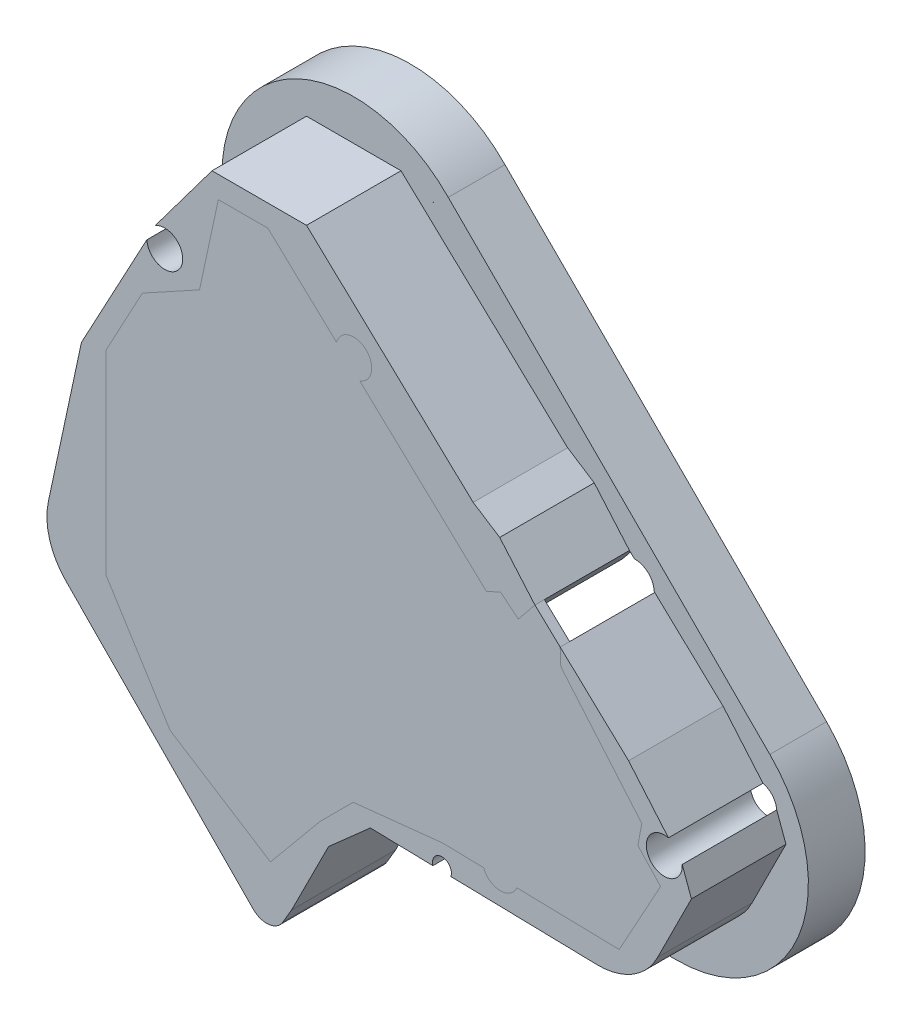
from build123d import *

# Parameters (mm, degrees)
BOSS_EXTRUDE1_DEPTH      = 27.94
SKETCH1_4_R              = 4.445
SKETCH1_4_R_2            = 2.032
SKETCH1_4_R_3            = 2.0193
BOSS_EXTRUDE2_DEPTH      = 5.08
BOSS_EXTRUDE3_DEPTH      = 2.54
BOSS_EXTRUDE4_DEPTH      = 2.54
BOSS_EXTRUDE4_DEPTH_BACK = 12.7
BOSS_EXTRUDE5_DEPTH      = 2.54
CUT_EXTRUDE2_DEPTH       = 176.272405321
BOSS_EXTRUDE7_DEPTH      = 2.54


with BuildPart() as part:
    # Sketch1 → Boss-Extrude1 (new body)
    with BuildSketch(Plane.XY):
        with BuildLine():
            ThreePointArc((-56.507300171, 12.537235488), (-56.195803813, 3.848751471), (-51.801985551, -3.653324614))
            Line((-51.801985551, -3.653324614), (-1.47570348, -54.850767255))
            ThreePointArc((-1.47570348, -54.850767255), (2.772016994, -56.331034197), (6.529742955, -53.858421196))
            Line((6.529742955, -53.858421196), (8.86743597, -49.87006403))
            Line((8.86743597, -49.87006403), (18.794900521, -30.155662993))
            Line((18.794900521, -30.155662993), (30.015464801, -20.224261861))
            Line((30.015464801, -20.224261861), (90.906521033, -21.585518505))
            ThreePointArc((90.906521033, -21.585518505), (100.475537269, -19.041819588), (107.200283399, -11.7744772))
            Line((107.200283399, -11.7744772), (116.311189347, 6.409978492))
            Line((116.311189347, 6.409978492), (113.829291982, 13.184806868))
            ThreePointArc((113.829291982, 13.184806868), (105.340047507, 9.70868308), (110.132255745, 17.530795873))
            Line((110.132255745, 17.530795873), (99.420817942, 30.122447115))
            Line((99.420817942, 30.122447115), (81.037096807, 47.39593724))
            Line((81.037096807, 47.39593724), (81.2028603, 42.898970903))
            Line((81.2028603, 42.898970903), (102.978646989, 17.30080971))
            Line((102.978646989, 17.30080971), (101.915981854, 11.639329767))
            Line((101.915981854, 11.639329767), (108.017908886, 5.157985196))
            Line((108.017908886, 5.157985196), (96.90201237, -15.075571619))
            Line((96.90201237, -15.075571619), (69.399721914, -14.460741167))
            ThreePointArc((69.399721914, -14.460741167), (64.864546386, -17.364816007), (60.463681575, -14.260970544))
            Line((60.463681575, -14.260970544), (49.393136216, -14.01348176))
            Line((49.393136216, -14.01348176), (25.4, -16.5608))
            Line((25.4, -16.5608), (16.5608, -25.4))
            Line((16.5608, -25.4), (3.175, -41.558795918))
            Line((3.175, -41.558795918), (-23.8101989, -24.409795746))
            Line((-23.8101989, -24.409795746), (-41.068354942, 3.175))
            Line((-41.068354942, 3.175), (-41.068354942, 55.377447672))
            Line((-41.068354942, 55.377447672), (-31.251976081, 73.622391025))
            Line((-31.251976081, 73.622391025), (-15.891878201, 82.061036959))
            Line((-15.891878201, 82.061036959), (-10.836023731, 105.600550299))
            Line((-10.836023731, 105.600550299), (2.486172742, 105.600550299))
            Line((2.486172742, 105.600550299), (20.916306787, 88.283450236))
            ThreePointArc((20.916306787, 88.283450236), (28.864622049, 90.486498065), (27.160323343, 82.416522777))
            Line((27.160323343, 82.416522777), (61.243243186, 50.391941083))
            Line((61.243243186, 50.391941083), (64.972407605, 52.198379473))
            Line((64.972407605, 52.198379473), (69.788594683, 48.28291809))
            Line((69.788594683, 48.28291809), (74.25115565, 53.77206135))
            Line((74.25115565, 53.77206135), (64.777919112, 64.777919112))
            Line((64.777919112, 64.777919112), (57.647971379, 69.372544921))
            Line((57.647971379, 69.372544921), (12.859978492, 111.455698118))
            Line((12.859978492, 111.455698118), (-12.540021508, 111.455698118))
            Line((-12.540021508, 111.455698118), (-27.811486315, 91.053304566))
            ThreePointArc((-27.811486315, 91.053304566), (-20.936169847, 84.786075459), (-30.05423809, 86.632414738))
            Line((-30.05423809, 86.632414738), (-47.625, 53.975))
            Line((-47.625, 53.975), (-56.507300171, 12.537235488))
        make_face()
    extrude(amount=BOSS_EXTRUDE1_DEPTH)

    # Sketch1<4> → Boss-Extrude2 (add)
    # profile 1 of 3: a face of its own
    with BuildSketch(Plane.XY):
        with Locations((-47.625, 3.175)):
            Circle(SKETCH1_4_R)
        with Locations((-47.625, 3.175)):
            Circle(SKETCH1_4_R_2, mode=Mode.SUBTRACT)
    # profile 2 of 3: a face of its own
    with BuildSketch(Plane.XY):
        with Locations((3.175, -47.625)):
            Circle(SKETCH1_4_R)
        with Locations((3.175, -47.625)):
            Circle(SKETCH1_4_R_2, mode=Mode.SUBTRACT)
    # profile 3 of 3: a face of its own
    with BuildSketch(Plane.XY):
        with Locations((60.138073453, 60.138073453)):
            Circle(SKETCH1_4_R)
        with Locations((60.138073453, 60.138073453)):
            Circle(SKETCH1_4_R_3, mode=Mode.SUBTRACT)
    extrude(amount=BOSS_EXTRUDE2_DEPTH)

    # Sketch1<5> → Boss-Extrude3 (add)
    with BuildSketch(Plane.XY):
        with BuildLine():
            ThreePointArc((21.234247588, 108.745854575), (-11.894017134, 114.773008011), (-30.140021508, 86.472975741))
            Line((-30.140021508, 86.472975741), (-30.05423809, 86.632414738))
            ThreePointArc((-30.05423809, 86.632414738), (-29.543873169, 89.152830265), (-27.811486315, 91.053304566))
            Line((-27.811486315, 91.053304566), (-12.540021508, 111.455698118))
            Line((-12.540021508, 111.455698118), (12.859978492, 111.455698118))
            Line((12.859978492, 111.455698118), (57.647971379, 69.372544921))
            Line((57.647971379, 69.372544921), (64.777919112, 64.777919112))
            Line((64.777919112, 64.777919112), (74.25115565, 53.77206135))
            Line((74.25115565, 53.77206135), (75.634193234, 52.472548271))
            ThreePointArc((75.634193234, 52.472548271), (76.84224881, 52.371963391), (77.992077705, 51.988024458))
            Line((77.992077705, 51.988024458), (59.152987425, 70.827114739))
            Line((59.152987425, 70.827114739), (21.936380205, 108.043721958))
            Line((21.936380205, 108.043721958), (21.234247588, 108.745854575))
        make_face()
    extrude(amount=BOSS_EXTRUDE3_DEPTH)

    # Sketch1<6> → Boss-Extrude4 (add, two sides: drawn at the far end of the back side and taken through both)
    with BuildSketch(Plane.XY.offset(-BOSS_EXTRUDE4_DEPTH_BACK)):
        with BuildLine():
            Line((-35.220021508, 86.432971366), (-35.220021508, 77.031173063))
            Line((-35.220021508, 77.031173063), (-30.140021508, 86.472975741))
            ThreePointArc((-30.140021508, 86.472975741), (-11.894017134, 114.773008011), (21.234247588, 108.745854575))
            ThreePointArc((21.234247588, 108.745854575), (21.588189914, 108.397664284), (21.936380205, 108.043721958))
            Line((21.936380205, 108.043721958), (59.152987425, 70.827114739))
            Line((59.152987425, 70.827114739), (77.992077705, 51.988024458))
            ThreePointArc((77.992077705, 51.988024458), (79.411823143, 50.988039688), (80.411807913, 49.56829425))
            Line((80.411807913, 49.56829425), (108.394788266, 21.585313897))
            ThreePointArc((108.394788266, 21.585313897), (114.963002612, -11.435329473), (86.969452862, -30.140021416))
            Line((86.969452862, -30.140021416), (57.15, -30.140021416))
            Line((57.15, -30.140021416), (57.15, -35.220021416))
            Line((57.15, -35.220021416), (86.969452862, -35.220021416))
            ThreePointArc((86.969452862, -35.220021416), (119.656310637, -13.37936131), (111.986890715, 25.177416345))
            Line((111.986890715, 25.177416345), (62.745089873, 74.419217187))
            Line((62.745089873, 74.419217187), (25.556770339, 111.607536721))
            ThreePointArc((25.556770339, 111.607536721), (-13.380914996, 119.660069496), (-35.220021508, 86.432971366))
        make_face()
    extrude(amount=BOSS_EXTRUDE4_DEPTH + BOSS_EXTRUDE4_DEPTH_BACK)

    # Sketch1<10> → Cut-Extrude2 (cut, through all)
    with BuildSketch(Plane.XY):
        with BuildLine():
            ThreePointArc((49.319303811, -17.316116234), (47.237072506, -18.322803482), (46.834178588, -20.60025445))
            Line((46.834178588, -20.60025445), (51.655181806, -20.708030913))
            ThreePointArc((51.655181806, -20.708030913), (51.354467139, -18.414850346), (49.319303811, -17.316116234))
        make_face()
    extrude(amount=CUT_EXTRUDE2_DEPTH, mode=Mode.SUBTRACT)

    # Sketch1<11> → Boss-Extrude7 (add)
    with BuildSketch(Plane.XY):
        with BuildLine():
            Line((90.906521033, -21.585518505), (57.15, -20.83087092))
            Line((57.15, -20.83087092), (57.15, -30.140021416))
            Line((57.15, -30.140021416), (86.969452862, -30.140021416))
            ThreePointArc((86.969452862, -30.140021416), (114.963002612, -11.435329473), (108.394788266, 21.585313897))
            Line((108.394788266, 21.585313897), (80.411807913, 49.56829425))
            ThreePointArc((80.411807913, 49.56829425), (80.761514312, 48.572829693), (80.89804013, 47.526595995))
            Line((80.89804013, 47.526595995), (81.037096807, 47.39593724))
            Line((81.037096807, 47.39593724), (99.420817942, 30.122447115))
            Line((99.420817942, 30.122447115), (110.132255745, 17.530795873))
            ThreePointArc((110.132255745, 17.530795873), (112.691826368, 15.96267793), (113.829291982, 13.184806868))
            Line((113.829291982, 13.184806868), (116.311189347, 6.409978492))
            Line((116.311189347, 6.409978492), (107.200283399, -11.7744772))
            ThreePointArc((107.200283399, -11.7744772), (100.475537269, -19.041819588), (90.906521033, -21.585518505))
        make_face()
    extrude(amount=BOSS_EXTRUDE7_DEPTH)


with BuildPart() as body_2:
    # Sketch2 → Boss-Extrude5 (new body)
    with BuildSketch(Plane.XY.offset(27.94)):
        with BuildLine():
            Line((-10.836023731, 105.600550299), (-15.891878201, 82.061036959))
            Line((-15.891878201, 82.061036959), (-31.251976081, 73.622391025))
            Line((-31.251976081, 73.622391025), (-41.068354942, 55.377447672))
            Line((-41.068354942, 55.377447672), (-41.068354942, 3.175))
            Line((-41.068354942, 3.175), (-23.8101989, -24.409795746))
            Line((-23.8101989, -24.409795746), (3.175, -41.558795918))
            Line((3.175, -41.558795918), (16.5608, -25.4))
            Line((16.5608, -25.4), (25.4, -16.5608))
            Line((25.4, -16.5608), (49.393136216, -14.01348176))
            Line((49.393136216, -14.01348176), (60.463681575, -14.260970544))
            ThreePointArc((60.463681575, -14.260970544), (64.864546386, -17.364816007), (69.399721914, -14.460741167))
            Line((69.399721914, -14.460741167), (96.90201237, -15.075571619))
            Line((96.90201237, -15.075571619), (108.017908886, 5.157985196))
            Line((108.017908886, 5.157985196), (101.915981854, 11.639329767))
            Line((101.915981854, 11.639329767), (102.978646989, 17.30080971))
            Line((102.978646989, 17.30080971), (81.2028603, 42.898970903))
            Line((81.2028603, 42.898970903), (81.037096807, 47.39593724))
            Line((81.037096807, 47.39593724), (74.25115565, 53.77206135))
            Line((74.25115565, 53.77206135), (69.788594683, 48.28291809))
            Line((69.788594683, 48.28291809), (64.972407605, 52.198379473))
            Line((64.972407605, 52.198379473), (61.243243186, 50.391941083))
            Line((61.243243186, 50.391941083), (27.160323343, 82.416522777))
            ThreePointArc((27.160323343, 82.416522777), (28.864622049, 90.486498065), (20.916306787, 88.283450236))
            Line((20.916306787, 88.283450236), (2.486172742, 105.600550299))
            Line((2.486172742, 105.600550299), (-10.836023731, 105.600550299))
        make_face()
    extrude(amount=-BOSS_EXTRUDE5_DEPTH)


solid = Compound([part.part, body_2.part])
